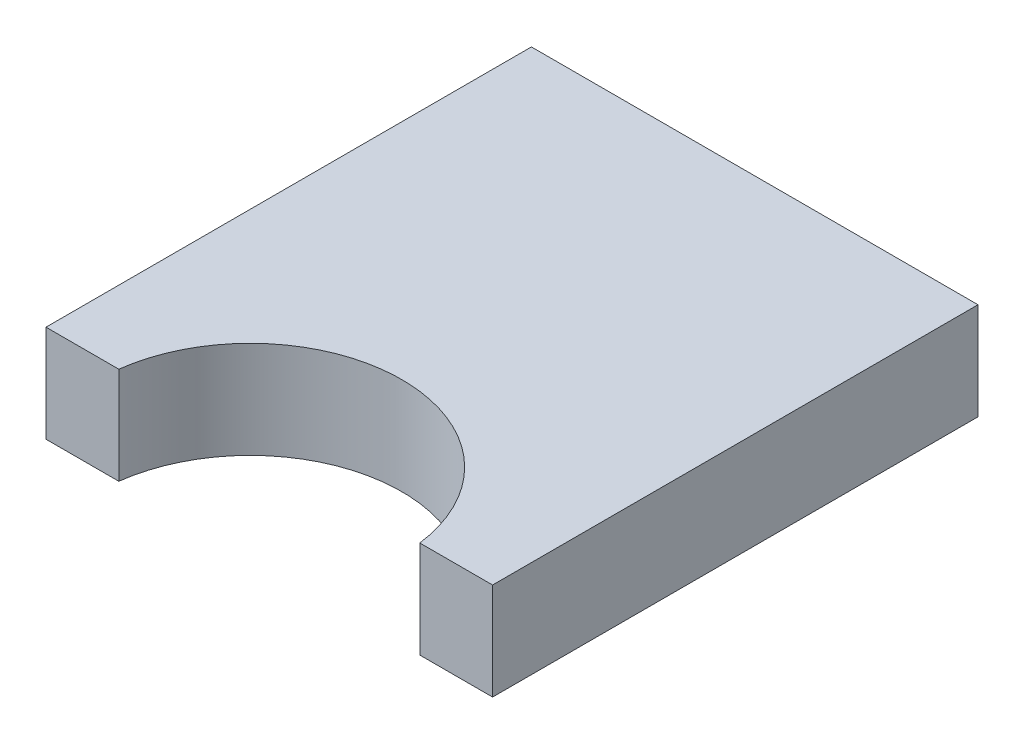
from build123d import *

# Parameters (mm, degrees)
BOSS_EXTRUDE1_DEPTH = 10.16
SKETCH6_R           = 1.0033
CUT_EXTRUDE1_DEPTH  = 4.064


with BuildPart() as part:
    # Sketch2 → Boss-Extrude1 (new body)
    with BuildSketch(Plane(origin=(0, 0, 0), x_dir=(1, 0, 0), z_dir=(0, 1, 0))):
        with BuildLine():
            Line((-14.986, -38.1), (-7.366, -38.1))
            ThreePointArc((-7.366, -38.1), (8.382, -24.229026197), (24.13, -38.1))
            Line((24.13, -38.1), (31.75, -38.1))
            Line((31.75, -38.1), (31.75, 12.7))
            Line((31.75, 12.7), (-14.986, 12.7))
            Line((-14.986, 12.7), (-14.986, -38.1))
        make_face()
    extrude(amount=-BOSS_EXTRUDE1_DEPTH)

    # Sketch6 → Cut-Extrude1 (cut)
    with BuildSketch(Plane(origin=(0, 0, -12.7), x_dir=(-1, 0, 0), z_dir=(0, 0, -1))):
        with Locations((11.176, -5.08)):
            Circle(SKETCH6_R)
        with Locations((-27.94, -5.08)):
            Circle(SKETCH6_R)
    extrude(amount=-CUT_EXTRUDE1_DEPTH, mode=Mode.SUBTRACT)


solid = part.part
